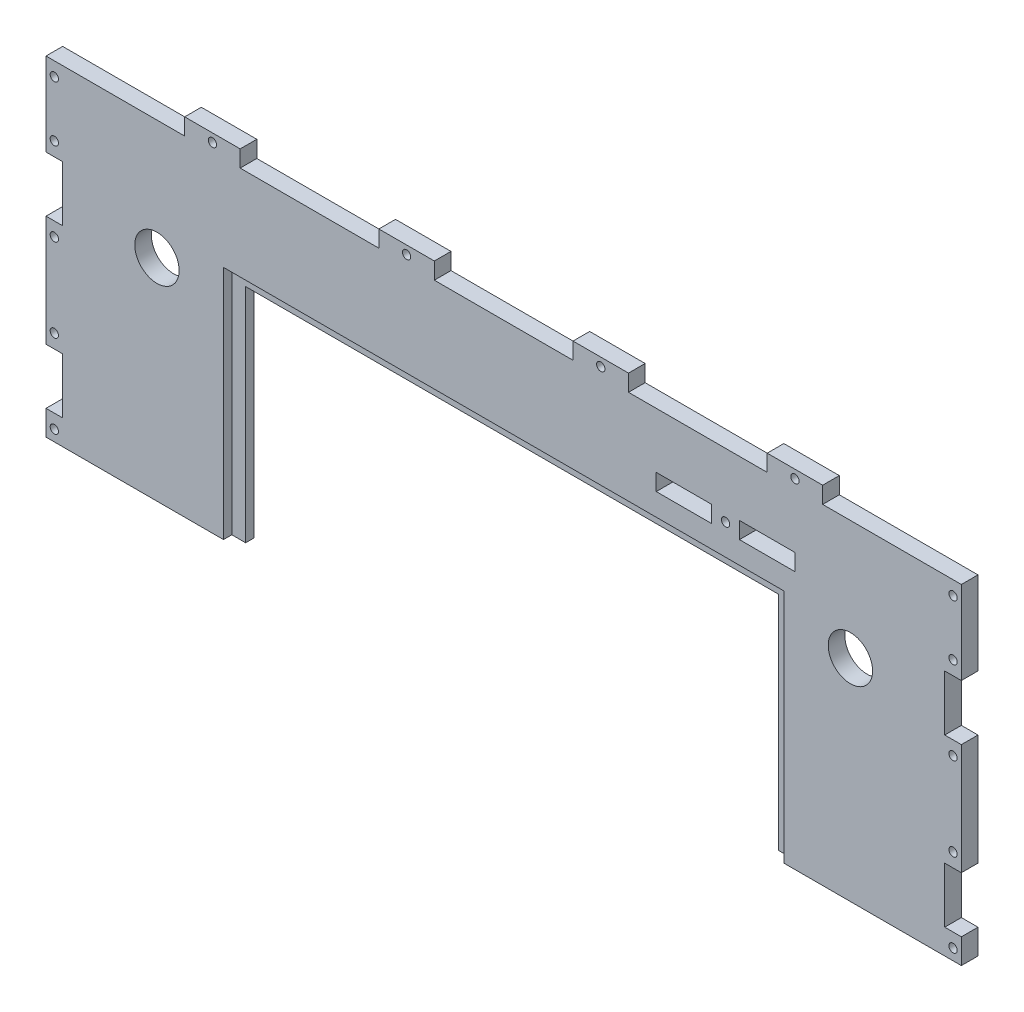
from build123d import *

# Parameters (mm, degrees)
ESQUISSE1_W                  = 330
ESQUISSE1_H                  = 238
ESQUISSE1_R                  = 8
ESQUISSE1_W_2                = 15
ESQUISSE1_H_2                = 6
ESQUISSE1_W_3                = 20
BOSS_EXTRU_1_DEPTH           = 6
ESQUISSE2_W                  = 20
ESQUISSE2_H                  = 6
BOSS_EXTRU_2_DEPTH           = 6
ESQUISSE3_W                  = 6
ESQUISSE3_H                  = 20
ESQUISSE3_W_2                = 12
ESQUISSE3_H_2                = 10
ENL_V_MAT_EXTRU_1_DEPTH      = 6
ESQUISSE4_R                  = 1.5
ENL_V_MAT_EXTRU_2_DEPTH      = 6
ESQUISSE5_W                  = 423.604058921
ESQUISSE5_H                  = 150.356061945
ENL_V_MAT_EXTRU_3_DEPTH      = 6
ESQUISSE6_W                  = 1.709615384
ESQUISSE6_H                  = 19.05
ESQUISSE6_W_2                = 1.709615385
ENL_V_MAT_EXTRU_4_DEPTH      = 6
ESQUISSE7_W                  = 1.58262541
ESQUISSE7_H                  = 1.953846154
ESQUISSE7_W_2                = 1.587980571
ESQUISSE7_H_2                = 1.936817114
ESQUISSE7_W_3                = 0.906225897
ESQUISSE7_W_4                = 1.709615385
ESQUISSE7_H_3                = 0.97063598
ESQUISSE7_W_5                = 1.216684544
ESQUISSE7_W_6                = 1.709615384
ESQUISSE7_H_4                = 3.052884616
ESQUISSE7_H_5                = 2.641773465
ESQUISSE7_W_7                = 1.710749653
ESQUISSE7_H_6                = 0.906659764
ESQUISSE7_W_8                = 1.70801118
ESQUISSE7_H_7                = 1.10546444
BOSS_EXTRU_5_DEPTH           = 6
ESQUISSE8_W                  = 192.05
ESQUISSE8_H                  = 80
ENL_V_MAT_EXTRU_5_DEPTH      = 6
ENL_V_MAT_EXTRU_7_DEPTH      = 208.089352696
ENL_V_MAT_EXTRU_7_DEPTH_BACK = 3


with BuildPart() as part:
    # Esquisse1 → Boss.-Extru.1 (new body)
    with BuildSketch(Plane.XY):
        Rectangle(ESQUISSE1_W, ESQUISSE1_H)
        with Locations((-125, 76)):
            Circle(ESQUISSE1_R, mode=Mode.SUBTRACT)
        with Locations((125, 76)):
            Circle(ESQUISSE1_R, mode=Mode.SUBTRACT)
        with Locations((-85, -58)):
            Rectangle(ESQUISSE1_W_2, ESQUISSE1_H_2, mode=Mode.SUBTRACT)
        with Locations((0, -58)):
            Rectangle(ESQUISSE1_W_2, ESQUISSE1_H_2, mode=Mode.SUBTRACT)
        with Locations((85, -58)):
            Rectangle(ESQUISSE1_W_2, ESQUISSE1_H_2, mode=Mode.SUBTRACT)
        with Locations((65, 96)):
            Rectangle(ESQUISSE1_W_3, ESQUISSE1_H_2, mode=Mode.SUBTRACT)
        with Locations((95, 96)):
            Rectangle(ESQUISSE1_W_3, ESQUISSE1_H_2, mode=Mode.SUBTRACT)
    extrude(amount=BOSS_EXTRU_1_DEPTH)

    # Esquisse2 → Boss.-Extru.2 (add)
    with BuildSketch(Plane.XY.offset(6)):
        with Locations((-105, 122)):
            Rectangle(ESQUISSE2_W, ESQUISSE2_H)
        with Locations((105, 122)):
            Rectangle(ESQUISSE2_W, ESQUISSE2_H)
        with Locations((35, 122)):
            Rectangle(ESQUISSE2_W, ESQUISSE2_H)
        with Locations((-35, 122)):
            Rectangle(ESQUISSE2_W, ESQUISSE2_H)
        with Locations((105, -122)):
            Rectangle(ESQUISSE2_W, ESQUISSE2_H)
        with Locations((-105, -122)):
            Rectangle(ESQUISSE2_W, ESQUISSE2_H)
        with Locations((-35, -122)):
            Rectangle(ESQUISSE2_W, ESQUISSE2_H)
        with Locations((35, -122)):
            Rectangle(ESQUISSE2_W, ESQUISSE2_H)
    extrude(amount=-BOSS_EXTRU_2_DEPTH)

    # Esquisse3 → Enlèv. mat.-Extru.1 (cut)
    with BuildSketch(Plane.XY.offset(6)):
        with Locations((-162, 79)):
            Rectangle(ESQUISSE3_W, ESQUISSE3_H)
        with Locations((-162, 19)):
            Rectangle(ESQUISSE3_W, ESQUISSE3_H)
        with Locations((-162, -19)):
            Rectangle(ESQUISSE3_W, ESQUISSE3_H)
        with Locations((-162, -79)):
            Rectangle(ESQUISSE3_W, ESQUISSE3_H)
        with Locations((162, -79)):
            Rectangle(ESQUISSE3_W, ESQUISSE3_H)
        with Locations((162, -19)):
            Rectangle(ESQUISSE3_W, ESQUISSE3_H)
        with Locations((162, 19)):
            Rectangle(ESQUISSE3_W, ESQUISSE3_H)
        with Locations((162, 79)):
            Rectangle(ESQUISSE3_W, ESQUISSE3_H)
        with Locations((159, -114)):
            Rectangle(ESQUISSE3_W_2, ESQUISSE3_H_2)
        with Locations((-159, -114)):
            Rectangle(ESQUISSE3_W_2, ESQUISSE3_H_2)
    extrude(amount=-ENL_V_MAT_EXTRU_1_DEPTH, mode=Mode.SUBTRACT)

    # Esquisse4 → Enlèv. mat.-Extru.2 (cut)
    with BuildSketch(Plane.XY.offset(6)):
        with Locations((-162, 114)):
            Circle(ESQUISSE4_R)
        with Locations((-162, 94)):
            Circle(ESQUISSE4_R)
        with Locations((-162, 64)):
            Circle(ESQUISSE4_R)
        with Locations((-162, 34)):
            Circle(ESQUISSE4_R)
        with Locations((-162, 4)):
            Circle(ESQUISSE4_R)
        with Locations((-105, 122)):
            Circle(ESQUISSE4_R)
        with Locations((-162, -4)):
            Circle(ESQUISSE4_R)
        with Locations((-162, -34)):
            Circle(ESQUISSE4_R)
        with Locations((-162, -64)):
            Circle(ESQUISSE4_R)
        with Locations((-162, -94)):
            Circle(ESQUISSE4_R)
        with Locations((-97.5, -58)):
            Circle(ESQUISSE4_R)
        with Locations((-72.5, -58)):
            Circle(ESQUISSE4_R)
        with Locations((162, -94)):
            Circle(ESQUISSE4_R)
        with Locations((162, -64)):
            Circle(ESQUISSE4_R)
        with Locations((162, -34)):
            Circle(ESQUISSE4_R)
        with Locations((162, -4)):
            Circle(ESQUISSE4_R)
        with Locations((80, 96)):
            Circle(ESQUISSE4_R)
        with Locations((162, 4)):
            Circle(ESQUISSE4_R)
        with Locations((162, 34)):
            Circle(ESQUISSE4_R)
        with Locations((162, 64)):
            Circle(ESQUISSE4_R)
        with Locations((162, 94)):
            Circle(ESQUISSE4_R)
        with Locations((162, 114)):
            Circle(ESQUISSE4_R)
        with Locations((-12.5, -58)):
            Circle(ESQUISSE4_R)
        with Locations((12.5, -58)):
            Circle(ESQUISSE4_R)
        with Locations((72.5, -58)):
            Circle(ESQUISSE4_R)
        with Locations((97.5, -58)):
            Circle(ESQUISSE4_R)
        with Locations((-35, 122)):
            Circle(ESQUISSE4_R)
        with Locations((35, 122)):
            Circle(ESQUISSE4_R)
        with Locations((105, 122)):
            Circle(ESQUISSE4_R)
    extrude(amount=-ENL_V_MAT_EXTRU_2_DEPTH, mode=Mode.SUBTRACT)

    # Esquisse5 → Enlèv. mat.-Extru.3 (cut)
    with BuildSketch(Plane.XY.offset(6)):
        with Locations((11.705214191, -75.178030973)):
            Rectangle(ESQUISSE5_W, ESQUISSE5_H)
    extrude(amount=-ENL_V_MAT_EXTRU_3_DEPTH, mode=Mode.SUBTRACT)

    # Esquisse6 → Enlèv. mat.-Extru.4 (cut)
    # profile 1 of 11: a face of its own
    with BuildSketch(Plane.XY.offset(6)):
        with BuildLine():
            Line((-81.011538462, 33.174909856), (-79.401141827, 34.140384615))
            add(Edge.make_bspline(
                [(-79.401141827, 34.140384615), (-79.251363993, 33.889662749), (-78.964395442, 33.409289328), (-78.485688759, 32.760184851), (-77.989665343, 32.208485112), (-77.47265197, 31.757399576), (-76.937804452, 31.402259207), (-76.381631246, 31.15078706), (-75.80600659, 30.993945823), (-75.414263362, 30.974895352), (-75.218689904, 30.965384615)],
                knots=[0, 0, 0, 0, 1.272034388, 2.437168799, 3.508375237, 4.49857839, 5.41946034, 6.295179144, 7.148887113, 8, 8, 8, 8], degree=3))
            add(Edge.make_bspline(
                [(-75.218689904, 30.965384615), (-75.051665706, 30.970036476), (-74.720539841, 30.9792588), (-74.233065347, 31.06787288), (-73.759635824, 31.204010324), (-73.31000881, 31.398978537), (-72.890388393, 31.634863724), (-72.522414809, 31.91977649), (-72.204300964, 32.238761695), (-71.944082784, 32.594630144), (-71.744438591, 32.977356339), (-71.59099319, 33.370199731), (-71.50583929, 33.77933151), (-71.493011817, 34.054797029), (-71.486538462, 34.193810096)],
                knots=[0, 0, 0, 0, 1.095163259, 2.171163733, 3.241058638, 4.321873601, 5.38011039, 6.391990106, 7.366004449, 8.327778327, 9.272591725, 10.192022065, 11.087607919, 12, 12, 12, 12], degree=3))
            add(Edge.make_bspline(
                [(-71.486538462, 34.193810096), (-71.494562924, 34.352419578), (-71.510875484, 34.674849478), (-71.648751111, 35.150553303), (-71.865644869, 35.621320006), (-72.065738687, 35.912519751), (-72.169621394, 36.063701923)],
                knots=[0, 0, 0, 0, 0.938893495, 1.908633276, 2.914225137, 4, 4, 4, 4], degree=3))
            add(Edge.make_bspline(
                [(-72.169621394, 36.063701923), (-72.254914309, 36.17281392), (-72.433976113, 36.401880909), (-72.741810575, 36.742849977), (-73.103031854, 37.0945588), (-73.505278346, 37.470437381), (-73.963202729, 37.853003818), (-74.462462486, 38.260501159), (-75.015804347, 38.6774326), (-75.403877322, 38.957046135), (-75.604116587, 39.101322115)],
                knots=[0, 0, 0, 0, 0.722233717, 1.516239348, 2.393582979, 3.351407094, 4.387010283, 5.505090956, 6.712668013, 8, 8, 8, 8], degree=3))
            add(Edge.make_bspline(
                [(-75.604116587, 39.101322115), (-75.804544337, 39.244080571), (-76.187746934, 39.517023867), (-76.723642932, 39.922104613), (-77.202856367, 40.292457674), (-77.623257299, 40.631569511), (-77.984660819, 40.939486117), (-78.289914814, 41.213250614), (-78.531243246, 41.460266853), (-78.665440049, 41.62051187), (-78.725691106, 41.692457933)],
                knots=[0, 0, 0, 0, 1.452282411, 2.77665338, 3.964542531, 5.026858415, 5.96415736, 6.766646006, 7.446254459, 8, 8, 8, 8], degree=3))
            add(Edge.make_bspline(
                [(-78.725691106, 41.692457933), (-78.809905959, 41.804586433), (-78.97552577, 42.025102178), (-79.1941436, 42.369770333), (-79.379958186, 42.722594106), (-79.525621737, 43.084521597), (-79.648283157, 43.45047171), (-79.730785608, 43.825219204), (-79.782445925, 44.207082542), (-79.787736309, 44.464058881), (-79.790384615, 44.592698317)],
                knots=[0, 0, 0, 0, 1.068054152, 2.10047183, 3.106115577, 4.101338837, 5.06977816, 6.043150881, 7.020423561, 8, 8, 8, 8], degree=3))
            add(Edge.make_bspline(
                [(-79.790384615, 44.592698317), (-79.783280549, 44.79424609), (-79.769224262, 45.193033694), (-79.650349446, 45.775587214), (-79.462718411, 46.331773285), (-79.199856235, 46.85608553), (-78.860998357, 47.334871798), (-78.468862411, 47.773639491), (-78.00180275, 48.142494203), (-77.489343472, 48.464776978), (-76.928422361, 48.717031228), (-76.340643301, 48.907318848), (-75.725072095, 49.015137808), (-75.308132177, 49.030610571), (-75.096574519, 49.038461538)],
                knots=[0, 0, 0, 0, 1.005424448, 1.989358655, 2.955360095, 3.929531133, 4.905563448, 5.876582895, 6.856512386, 7.866279853, 8.892233794, 9.918561126, 10.94386622, 12, 12, 12, 12], degree=3))
            add(Edge.make_bspline(
                [(-75.096574519, 49.038461538), (-74.872088773, 49.030718793), (-74.425658273, 49.015320944), (-73.768981828, 48.881440095), (-73.136735643, 48.659912153), (-72.628137302, 48.408513886), (-72.230086129, 48.157427181), (-71.926523112, 47.92871928), (-71.618906702, 47.665420475), (-71.304755575, 47.366829435), (-70.989392843, 47.030206404), (-70.668136624, 46.657856798), (-70.340235675, 46.252056115), (-70.129293065, 45.962362761), (-70.021153846, 45.813852163)],
                knots=[0, 0, 0, 0, 1.286793592, 2.559021753, 3.825965368, 5.121522368, 5.803751409, 6.523245864, 7.299691795, 8.125521123, 9.008227632, 9.944561021, 10.946284179, 12, 12, 12, 12], degree=3))
            Line((-70.021153846, 45.813852163), (-71.566676683, 44.642307692))
            add(Edge.make_bspline(
                [(-71.566676683, 44.642307692), (-71.659999544, 44.762533279), (-71.839717554, 44.994059648), (-72.11256519, 45.318297809), (-72.369732831, 45.614478933), (-72.623100007, 45.871736273), (-72.859285344, 46.104157885), (-73.088522388, 46.303147418), (-73.307512214, 46.470654588), (-73.583557113, 46.649417392), (-73.930363552, 46.82661779), (-74.365707956, 46.976563487), (-74.82065611, 47.066670324), (-75.130515962, 47.078584126), (-75.287379808, 47.084615385)],
                knots=[0, 0, 0, 0, 1.181633172, 2.275549214, 3.290209073, 4.226197932, 5.078386478, 5.862611352, 6.581680152, 7.217281963, 8.414376989, 9.595101626, 10.782541182, 12, 12, 12, 12], degree=3))
            add(Edge.make_bspline(
                [(-75.287379808, 47.084615385), (-75.484174594, 47.078020275), (-75.863674801, 47.065302227), (-76.402464514, 46.926400593), (-76.887390021, 46.707696467), (-77.304054696, 46.401182087), (-77.650965957, 46.038029255), (-77.901911383, 45.620132915), (-78.052951564, 45.15867441), (-78.0713826, 44.836774823), (-78.080769231, 44.672836538)],
                knots=[0, 0, 0, 0, 1.14458467, 2.207223713, 3.21896685, 4.227309161, 5.202851033, 6.127160689, 7.046193047, 8, 8, 8, 8], degree=3))
            add(Edge.make_bspline(
                [(-78.080769231, 44.672836538), (-78.078629499, 44.57077492), (-78.074346536, 44.366484791), (-78.01461228, 44.064670623), (-77.937871646, 43.763618904), (-77.816263893, 43.464683132), (-77.648377312, 43.162635263), (-77.427913426, 42.852274092), (-77.150255256, 42.530864077), (-76.937564661, 42.321818229), (-76.825270433, 42.211448317)],
                knots=[0, 0, 0, 0, 0.858281714, 1.717966888, 2.583508476, 3.4729293, 4.427298488, 5.488583878, 6.674047936, 8, 8, 8, 8], degree=3))
            add(Edge.make_bspline(
                [(-76.825270433, 42.211448317), (-76.783570677, 42.174235363), (-76.684501603, 42.0858259), (-76.503385493, 41.941087915), (-76.26421112, 41.762547112), (-75.973223996, 41.541636147), (-75.625058785, 41.285378474), (-75.2196772, 40.997050671), (-74.761598, 40.667292672), (-74.436540144, 40.43674663), (-74.264663462, 40.31484375)],
                knots=[0, 0, 0, 0, 0.420754252, 0.999615792, 1.744751191, 2.668019286, 3.750313428, 4.999500688, 6.413464383, 8, 8, 8, 8], degree=3))
            add(Edge.make_bspline(
                [(-74.264663462, 40.31484375), (-74.057911562, 40.164395779), (-73.657565164, 39.873074134), (-73.087928907, 39.435383076), (-72.571435466, 39.007314507), (-72.106271458, 38.591602102), (-71.687841428, 38.191399196), (-71.320787548, 37.801891029), (-71.001369774, 37.425868126), (-70.657494313, 36.94378025), (-70.306115324, 36.351700348), (-70.004355119, 35.626285936), (-69.814081828, 34.898051677), (-69.789199723, 34.408592753), (-69.776923077, 34.167097356)],
                knots=[0, 0, 0, 0, 1.163667725, 2.253281268, 3.268753668, 4.215851969, 5.092017293, 5.902905408, 6.650798638, 7.335211899, 8.59617414, 9.77448103, 10.901945474, 12, 12, 12, 12], degree=3))
            add(Edge.make_bspline(
                [(-69.776923077, 34.167097356), (-69.780499786, 33.996309397), (-69.787583746, 33.658050067), (-69.869013863, 33.16136172), (-69.988319469, 32.678956558), (-70.168136414, 32.216797503), (-70.387609604, 31.76642958), (-70.666100181, 31.339666579), (-70.988903437, 30.927063181), (-71.3592015, 30.539621607), (-71.764399911, 30.183951597), (-72.192664021, 29.86756342), (-72.644694792, 29.60375726), (-73.11804003, 29.388487677), (-73.612808463, 29.22012096), (-74.128833686, 29.098130915), (-74.666966312, 29.023260545), (-75.032728933, 29.015489444), (-75.218689904, 29.011538462)],
                knots=[0, 0, 0, 0, 0.983748083, 1.948392443, 2.894712957, 3.844097841, 4.80183111, 5.778335162, 6.776009319, 7.81870978, 8.863265674, 9.881300176, 10.883814829, 11.87499822, 12.874611388, 13.892143829, 14.928324115, 16, 16, 16, 16], degree=3))
            add(Edge.make_bspline(
                [(-75.218689904, 29.011538462), (-75.362573699, 29.01432075), (-75.648529222, 29.019850287), (-76.07149083, 29.068734113), (-76.485907737, 29.137897063), (-76.886579758, 29.247701643), (-77.278669098, 29.380926333), (-77.660470475, 29.544964972), (-78.032168925, 29.741545739), (-78.395847483, 29.966308659), (-78.750581205, 30.227880098), (-79.093042881, 30.532535842), (-79.434468876, 30.87187352), (-79.764781705, 31.255108157), (-80.090662676, 31.676048294), (-80.40568659, 32.138632278), (-80.716374225, 32.640340446), (-80.9113127, 32.993391841), (-81.011538462, 33.174909856)],
                knots=[0, 0, 0, 0, 0.915332311, 1.819136955, 2.706846663, 3.586547465, 4.459518054, 5.340707479, 6.227863349, 7.133153174, 8.059268498, 9.028702269, 10.047606654, 11.120612155, 12.245963614, 13.433783089, 14.680604001, 16, 16, 16, 16], degree=3))
        make_face()
    # profile 2 of 11: a face of its own
    with BuildSketch(Plane.XY.offset(6)):
        with BuildLine():
            Line((-65.869230769, 48.55), (-64.159615385, 48.55))
            Line((-64.159615385, 48.55), (-64.159615385, 37.136027644))
            add(Edge.make_bspline(
                [(-64.159615385, 37.136027644), (-64.159869805, 36.97447964), (-64.160352613, 36.667914462), (-64.157127644, 36.231569854), (-64.148095939, 35.843644041), (-64.142401842, 35.502641707), (-64.129734498, 35.21012761), (-64.1194037, 34.96451699), (-64.106120098, 34.766972831), (-64.090155559, 34.651688077), (-64.083293269, 34.602133413)],
                knots=[0, 0, 0, 0, 1.528628734, 2.90083645, 4.128790002, 5.200304208, 6.127813768, 6.898992206, 7.526736466, 8, 8, 8, 8], degree=3))
            add(Edge.make_bspline(
                [(-64.083293269, 34.602133413), (-64.055113101, 34.423353173), (-64.000340615, 34.075866319), (-63.860751044, 33.581065527), (-63.665801503, 33.135124305), (-63.434790085, 32.724127134), (-63.130356872, 32.359513618), (-62.765666201, 32.023625907), (-62.323827204, 31.729865085), (-61.832551622, 31.461255666), (-61.303041972, 31.245364289), (-60.761960651, 31.082114692), (-60.217441007, 30.982625252), (-59.852899308, 30.971105233), (-59.671875, 30.965384615)],
                knots=[0, 0, 0, 0, 1.035780045, 2.013197591, 2.933192213, 3.817615948, 4.702609284, 5.640816605, 6.646850145, 7.73207398, 8.84249596, 9.914020372, 10.964143139, 12, 12, 12, 12], degree=3))
            add(Edge.make_bspline(
                [(-59.671875, 30.965384615), (-59.51646107, 30.971229429), (-59.20653084, 30.982885298), (-58.746030125, 31.055065373), (-58.297538105, 31.185152738), (-57.858840118, 31.353009137), (-57.447626903, 31.574792454), (-57.063669026, 31.830992309), (-56.720965327, 32.13149722), (-56.408229653, 32.464057667), (-56.135896645, 32.839287149), (-55.899833717, 33.249015301), (-55.706471157, 33.699408174), (-55.610984258, 34.015934387), (-55.561929087, 34.178545673)],
                knots=[0, 0, 0, 0, 0.994687771, 1.983630487, 2.973142513, 3.978332533, 4.983357753, 5.956394766, 6.925816176, 7.893390482, 8.871859704, 9.88551698, 10.913711441, 12, 12, 12, 12], degree=3))
            add(Edge.make_bspline(
                [(-55.561929087, 34.178545673), (-55.545599833, 34.245757199), (-55.509211676, 34.395531565), (-55.475209903, 34.648740304), (-55.439795814, 34.947495271), (-55.415223655, 35.293942995), (-55.391268441, 35.686922574), (-55.376937002, 36.128481204), (-55.370312865, 36.617015519), (-55.368338848, 36.957940643), (-55.367307692, 37.136027644)],
                knots=[0, 0, 0, 0, 0.558680831, 1.244966039, 2.062412453, 2.990489873, 4.051219941, 5.244515665, 6.560634259, 8, 8, 8, 8], degree=3))
            Line((-55.367307692, 37.136027644), (-55.367307692, 48.55))
            Line((-55.367307692, 48.55), (-53.657692308, 48.55))
            Line((-53.657692308, 48.55), (-53.657692308, 37.044441106))
            add(Edge.make_bspline(
                [(-53.657692308, 37.044441106), (-53.659075449, 36.837077072), (-53.661774732, 36.432393552), (-53.685182156, 35.839386869), (-53.722503826, 35.276851356), (-53.775234705, 34.744711397), (-53.84510468, 34.244871187), (-53.922802666, 33.77294952), (-54.021751267, 33.332333946), (-54.137321636, 32.91958893), (-54.269439091, 32.526693493), (-54.440568769, 32.15381089), (-54.633379262, 31.789605372), (-54.862059016, 31.439585522), (-55.119023827, 31.102201569), (-55.409953689, 30.779499603), (-55.725226622, 30.466322794), (-56.070083654, 30.170704534), (-56.438840084, 29.899603022), (-56.830398996, 29.66121801), (-57.241752557, 29.45970375), (-57.671831487, 29.293827647), (-58.12081932, 29.169106757), (-58.588727377, 29.076169123), (-59.076620701, 29.023360904), (-59.408442616, 29.015512684), (-59.576472356, 29.011538462)],
                knots=[0, 0, 0, 0, 1.316592851, 2.569410997, 3.76748051, 4.895814652, 5.963796859, 6.97159953, 7.931736103, 8.829262218, 9.692595152, 10.560224239, 11.431080259, 12.30701507, 13.211635791, 14.121146779, 15.063487852, 16.031507147, 17.00238618, 17.966455255, 18.938106653, 19.907068911, 20.888905087, 21.893141452, 22.933117798, 24, 24, 24, 24], degree=3))
            add(Edge.make_bspline(
                [(-59.576472356, 29.011538462), (-59.759728471, 29.015809827), (-60.119276315, 29.02419023), (-60.649073509, 29.072211199), (-61.156969349, 29.162662745), (-61.648328051, 29.277833296), (-62.116460014, 29.436676209), (-62.56763719, 29.622267431), (-62.994132297, 29.850199376), (-63.402864355, 30.103800558), (-63.782910527, 30.389140375), (-64.131783536, 30.700146179), (-64.450059346, 31.031835947), (-64.73237325, 31.387800795), (-64.983402636, 31.765272229), (-65.199648512, 32.165318091), (-65.385322026, 32.587783498), (-65.481152056, 32.88144306), (-65.529597356, 33.029897837)],
                knots=[0, 0, 0, 0, 1.13879206, 2.234305948, 3.301075583, 4.341971843, 5.366689343, 6.369221514, 7.369726634, 8.367512178, 9.355451585, 10.318319045, 11.268648973, 12.207971039, 13.137398894, 14.081662264, 15.030215811, 16, 16, 16, 16], degree=3))
            add(Edge.make_bspline(
                [(-65.529597356, 33.029897837), (-65.557775888, 33.131312277), (-65.618895752, 33.351282458), (-65.68434773, 33.71533606), (-65.739370017, 34.134517255), (-65.791107412, 34.608854735), (-65.821636169, 35.138716152), (-65.848401085, 35.723871822), (-65.869419325, 36.3650293), (-65.869295378, 36.811640306), (-65.869230769, 37.044441106)],
                knots=[0, 0, 0, 0, 0.625038921, 1.35572334, 2.194682327, 3.136881307, 4.189498639, 5.346923369, 6.617055217, 8, 8, 8, 8], degree=3))
            Line((-65.869230769, 37.044441106), (-65.869230769, 48.55))
        make_face()
    # profile 3 of 11: a face of its own
    with BuildSketch(Plane.XY.offset(6)):
        with BuildLine():
            Line((-48.773076923, 29.5), (-48.773076923, 48.55))
            Line((-48.773076923, 48.55), (-44.926442308, 48.55))
            add(Edge.make_bspline(
                [(-44.926442308, 48.55), (-44.591875386, 48.547591155), (-43.945493835, 48.542937278), (-43.0114318, 48.513429421), (-42.147194464, 48.461229885), (-41.355624188, 48.38519575), (-40.634547877, 48.291834239), (-39.985984596, 48.174810609), (-39.406580789, 48.036626425), (-39.050239977, 47.918813331), (-38.881730769, 47.863100962)],
                knots=[0, 0, 0, 0, 1.314313732, 2.53924729, 3.670748893, 4.714932338, 5.66265055, 6.526160246, 7.303039223, 8, 8, 8, 8], degree=3))
            add(Edge.make_bspline(
                [(-38.881730769, 47.863100962), (-38.661323688, 47.779113835), (-38.225507627, 47.613044132), (-37.604983146, 47.299773406), (-37.020826527, 46.944827809), (-36.469905182, 46.547739471), (-35.964803541, 46.097264945), (-35.485789132, 45.612539951), (-35.052457563, 45.075937699), (-34.655628124, 44.498586693), (-34.29783832, 43.887288237), (-33.986838047, 43.243207146), (-33.72855274, 42.569614342), (-33.514141035, 41.868383036), (-33.345159602, 41.137971323), (-33.229869374, 40.377528709), (-33.153827272, 39.59006055), (-33.146185221, 39.055710968), (-33.142307692, 38.784585337)],
                knots=[0, 0, 0, 0, 0.984719456, 1.947108742, 2.898477687, 3.838006223, 4.779231079, 5.722358779, 6.681677486, 7.655904652, 8.64651281, 9.637519902, 10.640069247, 11.656948941, 12.698408672, 13.768548281, 14.867775369, 16, 16, 16, 16], degree=3))
            add(Edge.make_bspline(
                [(-33.142307692, 38.784585337), (-33.145731072, 38.549120596), (-33.152477201, 38.08511273), (-33.213052477, 37.401267284), (-33.301097876, 36.737709131), (-33.437409867, 36.097598107), (-33.602886405, 35.47532595), (-33.814962714, 34.877524734), (-34.057907343, 34.298710572), (-34.341207396, 33.746709738), (-34.652219792, 33.223741669), (-34.98598528, 32.730752009), (-35.342147865, 32.274775444), (-35.72410381, 31.854431142), (-36.126917238, 31.470352779), (-36.55322538, 31.119331953), (-37.00412827, 30.80823699), (-37.477606347, 30.524843158), (-37.987472136, 30.277626652), (-38.543383065, 30.068457598), (-39.147709905, 29.895121021), (-39.798969299, 29.750499431), (-40.498286514, 29.635778683), (-41.246347171, 29.558890747), (-42.042001933, 29.506895499), (-42.588351934, 29.50234313), (-42.869561298, 29.5)],
                knots=[0, 0, 0, 0, 1.105936401, 2.179363191, 3.223086493, 4.248585256, 5.251745608, 6.245858792, 7.225916811, 8.198733463, 9.158002045, 10.082870192, 10.993790845, 11.873723703, 12.748670949, 13.606408763, 14.465103618, 15.319838547, 16.196477973, 17.123216899, 18.106603292, 19.147568657, 20.255746949, 21.433717677, 22.679120308, 24, 24, 24, 24], degree=3))
            Line((-42.869561298, 29.5), (-48.773076923, 29.5))
        make_face()
        with BuildLine():
            Line((-47.063461538, 31.453846154), (-44.876832933, 31.453846154))
            add(Edge.make_bspline(
                [(-44.876832933, 31.453846154), (-44.562625658, 31.455196507), (-43.958289998, 31.457793731), (-43.089294327, 31.480584079), (-42.295293612, 31.517823767), (-41.576175111, 31.569939548), (-40.93234485, 31.638893011), (-40.362457297, 31.715772839), (-39.868380534, 31.811553249), (-39.569407455, 31.898372042), (-39.43125, 31.938491587)],
                knots=[0, 0, 0, 0, 1.375205317, 2.645023457, 3.804390687, 4.853969522, 5.800190428, 6.637939096, 7.370582563, 8, 8, 8, 8], degree=3))
            add(Edge.make_bspline(
                [(-39.43125, 31.938491587), (-39.257359629, 31.999732211), (-38.913732256, 32.120750728), (-38.419079492, 32.341500284), (-37.957759224, 32.602986406), (-37.5217318, 32.893647355), (-37.117182433, 33.22373488), (-36.739316886, 33.586071262), (-36.388895938, 33.982500538), (-36.069540062, 34.412530674), (-35.783744864, 34.873485133), (-35.536251458, 35.360832214), (-35.319345265, 35.869232138), (-35.149100354, 36.406491987), (-35.015665531, 36.967808719), (-34.921152016, 37.553221823), (-34.862289015, 38.162621971), (-34.855423134, 38.577107105), (-34.851923077, 38.788401442)],
                knots=[0, 0, 0, 0, 0.998632004, 1.973411704, 2.929992603, 3.868527914, 4.809262121, 5.754881198, 6.702106254, 7.672490631, 8.653608572, 9.636854334, 10.631411391, 11.644891563, 12.686317036, 13.754757253, 14.855430412, 16, 16, 16, 16], degree=3))
            add(Edge.make_bspline(
                [(-34.851923077, 38.788401442), (-34.854716827, 39.011196528), (-34.860205173, 39.448879446), (-34.929189634, 40.091085944), (-35.029999815, 40.708744914), (-35.175779591, 41.301897663), (-35.361549089, 41.871701408), (-35.593385639, 42.415004742), (-35.858271096, 42.937545529), (-36.173430686, 43.427263148), (-36.518592701, 43.890412785), (-36.901649445, 44.314710254), (-37.316515112, 44.701122088), (-37.758664792, 45.055666061), (-38.240559575, 45.364078354), (-38.750847521, 45.639958718), (-39.297014674, 45.87408807), (-39.676995204, 45.998614451), (-39.870102163, 46.061899038)],
                knots=[0, 0, 0, 0, 1.122418816, 2.205001699, 3.251619955, 4.274784885, 5.280384055, 6.268708349, 7.249350384, 8.229342522, 9.199999885, 10.157847722, 11.105861043, 12.055065948, 13.010012805, 13.98527497, 14.976112212, 16, 16, 16, 16], degree=3))
            add(Edge.make_bspline(
                [(-39.870102163, 46.061899038), (-40.02985626, 46.106075596), (-40.369537302, 46.200007078), (-40.923834956, 46.302470891), (-41.54766884, 46.392846807), (-42.243808642, 46.469362707), (-43.011460827, 46.524266556), (-43.851215786, 46.56547614), (-44.763436491, 46.593270811), (-45.395801425, 46.595168774), (-45.724008413, 46.596153846)],
                knots=[0, 0, 0, 0, 0.674548936, 1.434276114, 2.292660221, 3.240891867, 4.284742987, 5.42552168, 6.663806718, 8, 8, 8, 8], degree=3))
            Line((-45.724008413, 46.596153846), (-47.063461538, 46.596153846))
            Line((-47.063461538, 46.596153846), (-47.063461538, 31.453846154))
        make_face(mode=Mode.SUBTRACT)
    # profile 4 of 11: a face of its own
    with BuildSketch(Plane.XY.offset(6)):
        with BuildLine():
            Line((-29.234615385, 48.55), (-25.422325721, 48.55))
            add(Edge.make_bspline(
                [(-25.422325721, 48.55), (-25.167920436, 48.549153168), (-24.679434107, 48.547527156), (-23.979628164, 48.538460646), (-23.343754965, 48.51247451), (-22.772146982, 48.490112077), (-22.264814703, 48.449334511), (-21.820202449, 48.410360132), (-21.440357981, 48.359340635), (-21.210419848, 48.311958262), (-21.106310096, 48.290504808)],
                knots=[0, 0, 0, 0, 1.410062039, 2.707475311, 3.878576406, 4.937260626, 5.877586885, 6.699081471, 7.410979367, 8, 8, 8, 8], degree=3))
            add(Edge.make_bspline(
                [(-21.106310096, 48.290504808), (-20.966936899, 48.256069128), (-20.691163714, 48.187932374), (-20.294106925, 48.043916547), (-19.915750391, 47.877258304), (-19.557665776, 47.681512912), (-19.221646684, 47.455227326), (-18.904228449, 47.202307973), (-18.603970713, 46.924138753), (-18.333016411, 46.613706259), (-18.077533858, 46.288024685), (-17.86205862, 45.93585138), (-17.676313066, 45.567579351), (-17.528427824, 45.179463263), (-17.409349139, 44.775267048), (-17.325386322, 44.351329454), (-17.27503343, 43.909581861), (-17.269907044, 43.608276672), (-17.267307692, 43.455498798)],
                knots=[0, 0, 0, 0, 1.027469482, 2.033020251, 3.019912614, 3.986113645, 4.951240523, 5.91722682, 6.890402269, 7.87763091, 8.8651537, 9.85103654, 10.82876324, 11.815024772, 12.821070561, 13.842952187, 14.906261191, 16, 16, 16, 16], degree=3))
            add(Edge.make_bspline(
                [(-17.267307692, 43.455498798), (-17.275303239, 43.201670586), (-17.290904622, 42.706386001), (-17.436365543, 41.987597489), (-17.674634887, 41.317095648), (-18.002965931, 40.695724719), (-18.421083363, 40.135596777), (-18.923594012, 39.643614442), (-19.510778211, 39.231917204), (-20.057400631, 38.946424081), (-20.540259347, 38.763582678), (-20.937769235, 38.634933354), (-21.371385212, 38.535536085), (-21.836952705, 38.446490225), (-22.336409173, 38.379261717), (-22.86855753, 38.330022396), (-23.433777298, 38.299248217), (-23.822065661, 38.294665304), (-24.021814904, 38.292307692)],
                knots=[0, 0, 0, 0, 1.260483769, 2.459530307, 3.627416485, 4.787058657, 5.939039949, 7.08810263, 8.267026773, 9.491475466, 10.141966685, 10.831826277, 11.566392101, 12.351337768, 13.187381173, 14.07005841, 15.007169909, 16, 16, 16, 16], degree=3))
            Line((-24.021814904, 38.292307692), (-17.023076923, 29.5))
            Line((-17.023076923, 29.5), (-19.137199519, 29.5))
            Line((-19.137199519, 29.5), (-26.1359375, 38.292307692))
            Line((-26.1359375, 38.292307692), (-27.525, 38.292307692))
            Line((-27.525, 38.292307692), (-27.525, 29.5))
            Line((-27.525, 29.5), (-29.234615385, 29.5))
            Line((-29.234615385, 29.5), (-29.234615385, 48.55))
        make_face()
        with BuildLine():
            Line((-27.525, 46.596153846), (-27.525, 40.246153846))
            Line((-27.525, 40.246153846), (-24.037079327, 40.219441106))
            add(Edge.make_bspline(
                [(-24.037079327, 40.219441106), (-23.874228829, 40.219369061), (-23.558578183, 40.219229416), (-23.10191885, 40.24096697), (-22.676722242, 40.265695602), (-22.28461472, 40.303519897), (-21.925421117, 40.352266516), (-21.599320968, 40.413242759), (-21.305781957, 40.484283271), (-20.963434197, 40.594237835), (-20.581146791, 40.76844202), (-20.165685559, 41.021891377), (-19.811887121, 41.340674726), (-19.512977042, 41.705201679), (-19.272786851, 42.105993262), (-19.103448384, 42.538245214), (-18.99599309, 42.991045198), (-18.98331915, 43.302257471), (-18.976923077, 43.459314904)],
                knots=[0, 0, 0, 0, 1.146690395, 2.22261258, 3.21895312, 4.145990853, 4.996080663, 5.770904154, 6.481378293, 7.121626537, 8.300444488, 9.431385265, 10.535395872, 11.636531494, 12.74115979, 13.810798291, 14.895190096, 16, 16, 16, 16], degree=3))
            add(Edge.make_bspline(
                [(-18.976923077, 43.459314904), (-18.98346605, 43.612512684), (-18.996431836, 43.916094783), (-19.102288705, 44.360536237), (-19.281300909, 44.780000637), (-19.522540518, 45.17278162), (-19.816450204, 45.529319982), (-20.161080014, 45.83437663), (-20.547006861, 46.086105859), (-20.907711527, 46.24696613), (-21.230114883, 46.345589903), (-21.510039176, 46.414992666), (-21.826331647, 46.470751846), (-22.180528072, 46.515427149), (-22.571116377, 46.553826203), (-23.000071492, 46.579689455), (-23.464547396, 46.595004916), (-23.786475693, 46.595761957), (-23.953125, 46.596153846)],
                knots=[0, 0, 0, 0, 1.101028733, 2.181837193, 3.264309656, 4.369019818, 5.486613113, 6.575447106, 7.666700264, 8.788928104, 9.402425223, 10.0903467, 10.862060571, 11.710948788, 12.657782767, 13.684531032, 14.801375019, 16, 16, 16, 16], degree=3))
            Line((-23.953125, 46.596153846), (-27.525, 46.596153846))
        make_face(mode=Mode.SUBTRACT)
    # profile 5 of 11: a face of its own
    with BuildSketch(Plane.XY.offset(6)):
        with Locations((-12.260576923, 39.025)):
            Rectangle(ESQUISSE6_W, ESQUISSE6_H)
    # profile 6 of 11: a face of its own
    with BuildSketch(Plane.XY.offset(6)):
        Polygon((1.294230769, 48.55), (10.086538462, 29.5), (8.228094952, 29.5), (5.411808894, 35.605769231), (-3.224038462, 35.605769231), (-6.12046274, 29.5), (-7.986538462, 29.5), (1.05, 48.55), align=None)
        Polygon((1.153034856, 44.836929087), (-2.29672476, 37.559615385), (4.511207933, 37.559615385), align=None, mode=Mode.SUBTRACT)
    # profile 7 of 11: a face of its own
    with BuildSketch(Plane.XY.offset(6)):
        with BuildLine():
            Line((13.505769231, 48.55), (17.22265625, 48.55))
            add(Edge.make_bspline(
                [(17.22265625, 48.55), (17.404602681, 48.549043416), (17.757260148, 48.547189317), (18.270083109, 48.518433989), (18.750408779, 48.479225443), (19.198376454, 48.417013082), (19.613779134, 48.341946409), (19.997868703, 48.25104081), (20.349423783, 48.142038813), (20.769137391, 47.968704053), (21.247676988, 47.711130809), (21.76582824, 47.330519618), (22.208899886, 46.86497864), (22.590913984, 46.33983733), (22.894631506, 45.762155487), (23.114355825, 45.145701902), (23.253463689, 44.49842785), (23.267769881, 44.054055696), (23.275, 43.829477163)],
                knots=[0, 0, 0, 0, 1.001505555, 1.941167018, 2.826882275, 3.653841531, 4.429895133, 5.150066043, 5.825578002, 6.45369114, 7.647487171, 8.808567382, 9.977351308, 11.170798116, 12.373658725, 13.556498008, 14.765093433, 16, 16, 16, 16], degree=3))
            add(Edge.make_bspline(
                [(23.275, 43.829477163), (23.269049768, 43.619096825), (23.257357002, 43.205679619), (23.145545697, 42.601010253), (22.970499773, 42.025421476), (22.727175489, 41.481013921), (22.410934623, 40.980088113), (22.036148632, 40.518603136), (21.583973464, 40.116098097), (21.245192401, 39.891074585), (21.073106971, 39.776772837)],
                knots=[0, 0, 0, 0, 1.044552857, 2.05264487, 3.044412934, 4.028983338, 5.005914585, 5.980388656, 6.974128949, 8, 8, 8, 8], degree=3))
            add(Edge.make_bspline(
                [(21.073106971, 39.776772837), (21.289517298, 39.693687628), (21.703563864, 39.534725042), (22.273354874, 39.253680588), (22.76427253, 38.947998245), (23.180091282, 38.614177746), (23.535714804, 38.254356933), (23.846245814, 37.863259811), (24.111211579, 37.435784572), (24.338249063, 36.976388187), (24.515407293, 36.489761552), (24.648081858, 35.980469185), (24.724104688, 35.45033732), (24.734923136, 35.089555469), (24.740384615, 34.907421875)],
                knots=[0, 0, 0, 0, 1.27268992, 2.434971085, 3.483601985, 4.442670788, 5.356604649, 6.2567628, 7.179492994, 8.113709626, 9.066344395, 10.018646069, 10.999752585, 12, 12, 12, 12], degree=3))
            add(Edge.make_bspline(
                [(24.740384615, 34.907421875), (24.735067782, 34.721456471), (24.724606763, 34.355564329), (24.647427203, 33.818054239), (24.516749063, 33.304384887), (24.336747538, 32.811233821), (24.101821226, 32.339555089), (23.81591902, 31.888814324), (23.475024366, 31.463540324), (23.09368218, 31.059007461), (22.662269645, 30.695273362), (22.196819607, 30.371337873), (21.691470352, 30.104931449), (21.154521642, 29.881142817), (20.57995015, 29.710197923), (19.970335958, 29.590604342), (19.32620483, 29.510022641), (18.884191756, 29.503397568), (18.657512019, 29.5)],
                knots=[0, 0, 0, 0, 0.978564426, 1.925352924, 2.850884081, 3.763762016, 4.682927383, 5.618979971, 6.567305752, 7.547517671, 8.540179244, 9.531824382, 10.526200242, 11.540722885, 12.589160233, 13.674978461, 14.80764778, 16, 16, 16, 16], degree=3))
            Line((18.657512019, 29.5), (13.505769231, 29.5))
            Line((13.505769231, 29.5), (13.505769231, 48.55))
        make_face()
        with BuildLine():
            Line((15.215384615, 46.596153846), (15.215384615, 40.490384615))
            Line((15.215384615, 40.490384615), (16.364032452, 40.490384615))
            add(Edge.make_bspline(
                [(16.364032452, 40.490384615), (16.531938038, 40.492561339), (16.856365848, 40.496767213), (17.326192713, 40.50881507), (17.762301741, 40.542550135), (18.163940147, 40.576275504), (18.530475449, 40.631110046), (18.861095609, 40.696381458), (19.160989401, 40.765412698), (19.50682607, 40.882812334), (19.899108833, 41.056317966), (20.317300443, 41.325586103), (20.685969484, 41.646302939), (20.997285606, 42.016368031), (21.252073753, 42.423853986), (21.429041259, 42.862259149), (21.549041478, 43.320657296), (21.559881098, 43.635353787), (21.565384615, 43.795132212)],
                knots=[0, 0, 0, 0, 1.156816544, 2.235205308, 3.236616184, 4.169592532, 5.011045266, 5.787822928, 6.49130361, 7.128639758, 8.301311294, 9.436451833, 10.541879658, 11.654887649, 12.756523258, 13.837046038, 14.901820046, 16, 16, 16, 16], degree=3))
            add(Edge.make_bspline(
                [(21.565384615, 43.795132212), (21.562520692, 43.900863911), (21.556902793, 44.108268185), (21.510892675, 44.410615384), (21.432692019, 44.694970665), (21.332247938, 44.965230894), (21.191883789, 45.212945393), (21.026619796, 45.446679073), (20.826944824, 45.658472175), (20.599665737, 45.856426159), (20.338361661, 46.031928517), (20.043188487, 46.185638957), (19.710152702, 46.309413755), (19.34486702, 46.417814528), (18.941708672, 46.493950813), (18.505330031, 46.557378537), (18.032156775, 46.589669604), (17.704795574, 46.593944222), (17.535576923, 46.596153846)],
                knots=[0, 0, 0, 0, 0.91205012, 1.789085906, 2.630437955, 3.453916878, 4.269457761, 5.079663411, 5.91843418, 6.774407191, 7.675494373, 8.627863946, 9.638891023, 10.736472738, 11.911756761, 13.175263542, 14.539845004, 16, 16, 16, 16], degree=3))
            Line((17.535576923, 46.596153846), (15.215384615, 46.596153846))
        make_face(mode=Mode.SUBTRACT)
        with BuildLine():
            Line((15.215384615, 38.536538462), (15.215384615, 31.453846154))
            Line((15.215384615, 31.453846154), (17.650060096, 31.453846154))
            add(Edge.make_bspline(
                [(17.650060096, 31.453846154), (17.824334536, 31.455934836), (18.160225543, 31.459960496), (18.64519081, 31.473102571), (19.094678846, 31.502996243), (19.506638557, 31.550054368), (19.885518306, 31.601099927), (20.226772947, 31.669741327), (20.533168757, 31.748384955), (20.888447489, 31.869946664), (21.288516584, 32.058794599), (21.719649959, 32.34353346), (22.102969804, 32.682750321), (22.428481286, 33.075348582), (22.695251981, 33.50223909), (22.889319529, 33.954787352), (23.009012621, 34.425515723), (23.023502428, 34.746463115), (23.030769231, 34.907421875)],
                knots=[0, 0, 0, 0, 1.160039823, 2.235823828, 3.228722157, 4.157150951, 4.99529583, 5.772374946, 6.472645482, 7.099169577, 8.269452708, 9.405989375, 10.527446681, 11.663510218, 12.788923519, 13.866172445, 14.929861265, 16, 16, 16, 16], degree=3))
            add(Edge.make_bspline(
                [(23.030769231, 34.907421875), (23.029266434, 35.008078486), (23.026285082, 35.207768106), (22.981323735, 35.501224208), (22.915933958, 35.785482176), (22.831398582, 36.061313877), (22.708284054, 36.323732397), (22.564557002, 36.577927757), (22.396038516, 36.824235981), (22.133452413, 37.135634103), (21.751516326, 37.494410988), (21.208826591, 37.845679393), (20.591757369, 38.128968171), (20.144204872, 38.249252464), (19.913010817, 38.311388221)],
                knots=[0, 0, 0, 0, 0.723448775, 1.435228256, 2.130040452, 2.821711965, 3.505591119, 4.210454504, 4.921174351, 5.648778258, 7.137944449, 8.670945889, 10.280296675, 12, 12, 12, 12], degree=3))
            add(Edge.make_bspline(
                [(19.913010817, 38.311388221), (19.820323881, 38.33019375), (19.619359486, 38.370968014), (19.291658227, 38.414008514), (18.917538712, 38.452353768), (18.496137051, 38.480717355), (18.026920087, 38.510035542), (17.508885716, 38.521437354), (16.944149475, 38.53504047), (16.552305276, 38.536026358), (16.348768029, 38.536538462)],
                knots=[0, 0, 0, 0, 0.634451884, 1.375622551, 2.216452059, 3.157844607, 4.20941857, 5.370758133, 6.634282058, 8, 8, 8, 8], degree=3))
            Line((16.348768029, 38.536538462), (15.215384615, 38.536538462))
        make_face(mode=Mode.SUBTRACT)
    # profile 8 of 11: a face of its own
    with BuildSketch(Plane.XY.offset(6)):
        with BuildLine():
            add(Edge.make_bspline(
                [(37.5625, 49.038461538), (37.915241262, 49.029527201), (38.608054204, 49.011979424), (39.626276147, 48.877654589), (40.598343737, 48.645269681), (41.532175493, 48.335772591), (42.416601551, 47.922908007), (43.258278951, 47.423878843), (44.055205079, 46.833456974), (44.796638598, 46.156206468), (45.475128571, 45.419333669), (46.07289518, 44.632961044), (46.573868236, 43.801843278), (46.985270878, 42.928477899), (47.308024739, 42.014840074), (47.530741248, 41.056059002), (47.673007465, 40.058346874), (47.689639625, 39.37784351), (47.698076923, 39.032632212)],
                knots=[0, 0, 0, 0, 1.065120563, 2.091984664, 3.0946048, 4.079830382, 5.057816894, 6.036188127, 7.030412546, 8.04752943, 9.064399622, 10.05169764, 11.02544977, 11.989514704, 12.962713494, 13.945757189, 14.957906945, 16, 16, 16, 16], degree=3))
            add(Edge.make_bspline(
                [(47.698076923, 39.032632212), (47.689640862, 38.689963825), (47.673012408, 38.014524737), (47.53057949, 37.02314399), (47.30719919, 36.070150342), (46.988268084, 35.157134718), (46.578826551, 34.283133978), (46.074517691, 33.450447843), (45.480477673, 32.658803331), (44.804437526, 31.916872967), (44.067468998, 31.236529591), (43.277001403, 30.643699711), (42.450812047, 30.133572689), (41.578269207, 29.726535835), (40.670944721, 29.401205811), (39.720718077, 29.179395068), (38.732041833, 29.036318447), (38.057829655, 29.019889096), (37.715144231, 29.011538462)],
                knots=[0, 0, 0, 0, 1.043624062, 2.057103931, 3.04512605, 4.022047818, 4.998200453, 5.980619268, 6.982898556, 8.009068085, 9.034988726, 10.034168286, 11.015286542, 11.987931943, 12.962482838, 13.94673481, 14.956375938, 16, 16, 16, 16], degree=3))
            add(Edge.make_bspline(
                [(37.715144231, 29.011538462), (37.369934723, 29.019971553), (36.689434891, 29.036595421), (35.690469027, 29.179097067), (34.731014449, 29.401934735), (33.813814909, 29.720393237), (32.938358935, 30.131967022), (32.102934342, 30.633822285), (31.310894412, 31.229309725), (30.568805764, 31.905130652), (29.889813699, 32.6408501), (29.297851954, 33.429162259), (28.795883838, 34.254601245), (28.385691985, 35.119457769), (28.060946856, 36.019550907), (27.839396346, 36.960884763), (27.696053521, 37.938092645), (27.679535286, 38.603443277), (27.671153846, 38.941045673)],
                knots=[0, 0, 0, 0, 1.053102029, 2.075944431, 3.073151272, 4.055350789, 5.033113405, 6.020478099, 7.024410459, 8.052272461, 9.079885166, 10.07527673, 11.055994387, 12.023226415, 12.992069828, 13.970394897, 14.97016774, 16, 16, 16, 16], degree=3))
            add(Edge.make_bspline(
                [(27.671153846, 38.941045673), (27.674063791, 39.167646344), (27.67984697, 39.617989016), (27.749470325, 40.286734368), (27.850499013, 40.944724948), (27.995289422, 41.590089679), (28.184655496, 42.221248753), (28.408095816, 42.842555048), (28.680999832, 43.447712173), (28.989504502, 44.039586919), (29.333829485, 44.608952807), (29.714153207, 45.147140252), (30.117117141, 45.658665392), (30.558877898, 46.130272656), (31.024875978, 46.575681557), (31.522670865, 46.988047202), (32.049225081, 47.371088007), (32.606804319, 47.716275863), (33.181669501, 48.028473439), (33.774270249, 48.296380942), (34.376558159, 48.52632022), (34.991354172, 48.71268814), (35.617025688, 48.85981965), (36.254938259, 48.960008247), (36.904583679, 49.029809177), (37.342251, 49.035565009), (37.5625, 49.038461538)],
                knots=[0, 0, 0, 0, 1.037015668, 2.060948919, 3.074880161, 4.083647147, 5.086022904, 6.090072063, 7.104153813, 8.122640571, 9.144368836, 10.147691507, 11.138137339, 12.123020368, 13.103399296, 14.087645067, 15.080126199, 16.082011238, 17.087798457, 18.072939717, 19.057185487, 20.037253025, 21.01195951, 21.997135196, 22.992090687, 24, 24, 24, 24], degree=3))
        make_face()
        with BuildLine():
            add(Edge.make_bspline(
                [(37.646454327, 47.084615385), (37.465671821, 47.082411625), (37.105835104, 47.078025173), (36.570886414, 47.02024535), (36.042973174, 46.937895526), (35.52198636, 46.820430391), (35.010105842, 46.660388333), (34.502560278, 46.476197104), (34.003977941, 46.251836596), (33.516004801, 45.99834802), (33.042938463, 45.717774608), (32.596555045, 45.407685419), (32.17569894, 45.075352431), (31.781400589, 44.720000059), (31.41481778, 44.339818655), (31.068735334, 43.940571824), (30.757025182, 43.51084796), (30.471353686, 43.062299888), (30.215714441, 42.595511853), (29.988391582, 42.115398174), (29.802441762, 41.618042479), (29.650790828, 41.108840564), (29.525061858, 40.588598891), (29.4454115, 40.053370914), (29.3869968, 39.50584609), (29.38286107, 39.13583057), (29.380769231, 38.948677885)],
                knots=[0, 0, 0, 0, 1.008559885, 2.007477868, 2.99961109, 3.989939068, 4.984837346, 5.991145699, 7.001802488, 8.033829008, 9.059044045, 10.069351652, 11.065060232, 12.050310815, 13.029377138, 14.011219647, 14.996725999, 15.989392538, 16.977580475, 17.965360261, 18.951710183, 19.937753436, 20.929683414, 21.935841486, 22.955955122, 24, 24, 24, 24], degree=3))
            add(Edge.make_bspline(
                [(29.380769231, 38.948677885), (29.387708122, 38.67347494), (29.401359069, 38.132065611), (29.520870986, 37.338670428), (29.704959161, 36.576189898), (29.976325684, 35.848796077), (30.315691172, 35.150236481), (30.734937532, 34.486708082), (31.231647698, 33.858031552), (31.795873464, 33.268595874), (32.412672767, 32.730592282), (33.067626626, 32.258351444), (33.753718404, 31.858789941), (34.472737264, 31.533279476), (35.220844584, 31.275343903), (36.002860969, 31.098567353), (36.813577042, 30.982223803), (37.366193893, 30.971050946), (37.646454327, 30.965384615)],
                knots=[0, 0, 0, 0, 1.032063989, 2.030389145, 3.003944642, 3.970395727, 4.937377036, 5.913328081, 6.909231446, 7.93887556, 8.970685674, 9.976071282, 10.964166581, 11.944589148, 12.933237628, 13.927779006, 14.949070134, 16, 16, 16, 16], degree=3))
            add(Edge.make_bspline(
                [(37.646454327, 30.965384615), (37.8348289, 30.967972718), (38.208432255, 30.973105702), (38.764123598, 31.024805643), (39.309803836, 31.107710532), (39.844707588, 31.227075958), (40.368227776, 31.376467181), (40.88254949, 31.553946386), (41.38219447, 31.775368366), (41.873465873, 32.020013646), (42.343708274, 32.298906503), (42.792610814, 32.598471289), (43.208858648, 32.930314782), (43.602862022, 33.280387447), (43.970949872, 33.655747819), (44.310633058, 34.055907884), (44.620767777, 34.483393461), (44.906330796, 34.931261169), (45.161074269, 35.399326488), (45.38302908, 35.881180878), (45.571330796, 36.37563783), (45.723341658, 36.883410526), (45.842461099, 37.403534575), (45.924538949, 37.9367064), (45.981952594, 38.481859393), (45.986280085, 38.850579523), (45.988461538, 39.036448317)],
                knots=[0, 0, 0, 0, 1.047197238, 2.076906641, 3.100256066, 4.114471768, 5.12198147, 6.126382909, 7.136867548, 8.15857795, 9.17633901, 10.174870724, 11.156907918, 12.133735059, 13.104061851, 14.077631395, 15.04955518, 16.038496417, 17.029181396, 18.010275684, 18.986308667, 19.968651475, 20.955262928, 21.950658345, 22.966943676, 24, 24, 24, 24], degree=3))
            add(Edge.make_bspline(
                [(45.988461538, 39.036448317), (45.986278338, 39.221045562), (45.981947557, 39.587228201), (45.924566374, 40.128579226), (45.842374385, 40.657914563), (45.723923074, 41.173156119), (45.571250094, 41.674435234), (45.382996196, 42.161281104), (45.161007638, 42.635507423), (44.906237159, 43.095942097), (44.619856748, 43.537764599), (44.306923796, 43.960143445), (43.962035258, 44.355146508), (43.595045037, 44.732525343), (43.196786361, 45.084231285), (42.769063275, 45.410381004), (42.3170684, 45.71884554), (41.838493018, 45.997114669), (41.344586642, 46.254094993), (40.83778067, 46.474264025), (40.323816571, 46.66134656), (39.804001331, 46.820914613), (39.273959692, 46.937435463), (38.737273138, 47.020319563), (38.194684188, 47.078005063), (37.82977752, 47.082404952), (37.646454327, 47.084615385)],
                knots=[0, 0, 0, 0, 1.02996197, 2.043119294, 3.035359645, 4.018872909, 4.991431989, 5.957985074, 6.929999688, 7.912076566, 8.892894881, 9.867085534, 10.843653904, 11.817741046, 12.803660682, 13.806313499, 14.818574707, 15.856120519, 16.894564902, 17.924820532, 18.937903209, 19.946497019, 20.957711757, 21.963978472, 22.977135795, 24, 24, 24, 24], degree=3))
        make_face(mode=Mode.SUBTRACT)
    # profile 9 of 11: a face of its own
    with BuildSketch(Plane.XY.offset(6)):
        Polygon((49.407692308, 46.596153846), (49.407692308, 48.55), (59.421153846, 48.55), (59.421153846, 46.596153846), (55.269230769, 46.596153846), (55.269230769, 29.5), (53.559615385, 29.5), (53.559615385, 46.596153846), align=None)
    # profile 10 of 11: a face of its own
    with BuildSketch(Plane.XY.offset(6)):
        with Locations((63.206730769, 39.025)):
            Rectangle(ESQUISSE6_W_2, ESQUISSE6_H)
    # profile 11 of 11: a face of its own
    with BuildSketch(Plane.XY.offset(6)):
        Polygon((68.946153846, 48.55), (70.655769231, 48.55), (70.655769231, 41.295582933), (78.597085337, 48.55), (81.035576923, 48.55), (71.674669471, 40.001923077), (81.768269231, 29.5), (79.490054087, 29.5), (70.655769231, 38.692998798), (70.655769231, 29.5), (68.946153846, 29.5), align=None)
    extrude(amount=-ENL_V_MAT_EXTRU_4_DEPTH, mode=Mode.SUBTRACT)


with BuildPart() as enl_v_mat_extru_4_piece_1:
    # of the separate pieces the step leaves, piece 1, a body of its own (enl_v_mat_extru_4_pieces)
    add(part.part.solids().sort_by_distance((-165, 119, 0))[0])



with BuildPart() as enl_v_mat_extru_4_piece_2:
    # of the separate pieces the step leaves, piece 2, a body of its own (enl_v_mat_extru_4_pieces)
    add(part.part.solids().sort_by_distance((37.646454327, 47.084615385, 0))[0])


with BuildPart() as enl_v_mat_extru_4_piece_3:
    # of the separate pieces the step leaves, piece 3, a body of its own (enl_v_mat_extru_4_pieces)
    add(part.part.solids().sort_by_distance((-47.063461538, 31.453846154, 0))[0])


with BuildPart() as enl_v_mat_extru_4_piece_4:
    # of the separate pieces the step leaves, piece 4, a body of its own (enl_v_mat_extru_4_pieces)
    add(part.part.solids().sort_by_distance((-27.525, 46.596153846, 0))[0])


with BuildPart() as enl_v_mat_extru_4_piece_5:
    # of the separate pieces the step leaves, piece 5, a body of its own (enl_v_mat_extru_4_pieces)
    add(part.part.solids().sort_by_distance((15.215384615, 38.536538462, 0))[0])


with BuildPart() as enl_v_mat_extru_4_piece_6:
    # of the separate pieces the step leaves, piece 6, a body of its own (enl_v_mat_extru_4_pieces)
    add(part.part.solids().sort_by_distance((15.215384615, 46.596153846, 0))[0])


with BuildPart() as enl_v_mat_extru_4_piece_7:
    # of the separate pieces the step leaves, piece 7, a body of its own (enl_v_mat_extru_4_pieces)
    add(part.part.solids().sort_by_distance((1.153034856, 44.836929087, 0))[0])


with BuildPart() as enl_v_mat_extru_4_piece_1_1:
    add(enl_v_mat_extru_4_piece_1.part)

    add(enl_v_mat_extru_4_piece_2.part)  # Boss.-Extru.5 merges Enlèv. mat.-Extru.4 piece 2

    add(enl_v_mat_extru_4_piece_3.part)  # Boss.-Extru.5 merges Enlèv. mat.-Extru.4 piece 3

    add(enl_v_mat_extru_4_piece_4.part)  # Boss.-Extru.5 merges Enlèv. mat.-Extru.4 piece 4

    add(enl_v_mat_extru_4_piece_5.part)  # Boss.-Extru.5 merges Enlèv. mat.-Extru.4 piece 5

    add(enl_v_mat_extru_4_piece_6.part)  # Boss.-Extru.5 merges Enlèv. mat.-Extru.4 piece 6

    add(enl_v_mat_extru_4_piece_7.part)  # Boss.-Extru.5 merges Enlèv. mat.-Extru.4 piece 7
    # Esquisse7 → Boss.-Extru.5 (add)
    with BuildSketch(Plane.XY.offset(6)):
        with Locations((-45.178834531, 30.476923077)):
            Rectangle(ESQUISSE7_W, ESQUISSE7_H)
        with Locations((-44.384844246, 47.562132152)):
            Rectangle(ESQUISSE7_W_2, ESQUISSE7_H_2)
        with Locations((-25.875438669, 47.573076923)):
            Rectangle(ESQUISSE7_W_3, ESQUISSE7_H)
        with Locations((-28.379807693, 42.935835856)):
            Rectangle(ESQUISSE7_W_4, ESQUISSE7_H_3)
        with Locations((1.279551333, 36.582692308)):
            Rectangle(ESQUISSE7_W_5, ESQUISSE7_H)
        with Locations((14.360576923, 42.016826923)):
            Rectangle(ESQUISSE7_W_6, ESQUISSE7_H_4)
        with Locations((14.360576923, 34.284882499)):
            Rectangle(ESQUISSE7_W_6, ESQUISSE7_H_5)
        with Locations((28.537557324, 38.999545465)):
            Rectangle(ESQUISSE7_W_7, ESQUISSE7_H_6)
        with Locations((46.827350298, 39.034548512)):
            Rectangle(ESQUISSE7_W_8, ESQUISSE7_H_7)
    extrude(amount=-BOSS_EXTRU_5_DEPTH)

    # Esquisse8 → Enlèv. mat.-Extru.5 (cut)
    with BuildSketch(Plane.XY.offset(6)):
        with Locations((0.010576923, 40)):
            Rectangle(ESQUISSE8_W, ESQUISSE8_H)
    extrude(amount=-ENL_V_MAT_EXTRU_5_DEPTH, mode=Mode.SUBTRACT)

    # Esquisse11 → Enlèv. mat.-Extru.7 (cut, two sides: drawn at the far end of the back side and taken through both)
    with BuildSketch(Plane.XY.offset(6).offset(-ENL_V_MAT_EXTRU_7_DEPTH_BACK)):
        Polygon((-101.014423077, -597.877293961), (-101.014423077, 0), (-101.014423077, 85), (101.035576923, 85), (101.035576923, 0), (101.035576923, -597.877293961), (101.035576923, -1793.631881884), (-101.014423077, -1793.631881884), align=None)
    extrude(amount=ENL_V_MAT_EXTRU_7_DEPTH + ENL_V_MAT_EXTRU_7_DEPTH_BACK, mode=Mode.SUBTRACT)


solid = enl_v_mat_extru_4_piece_1_1.part
